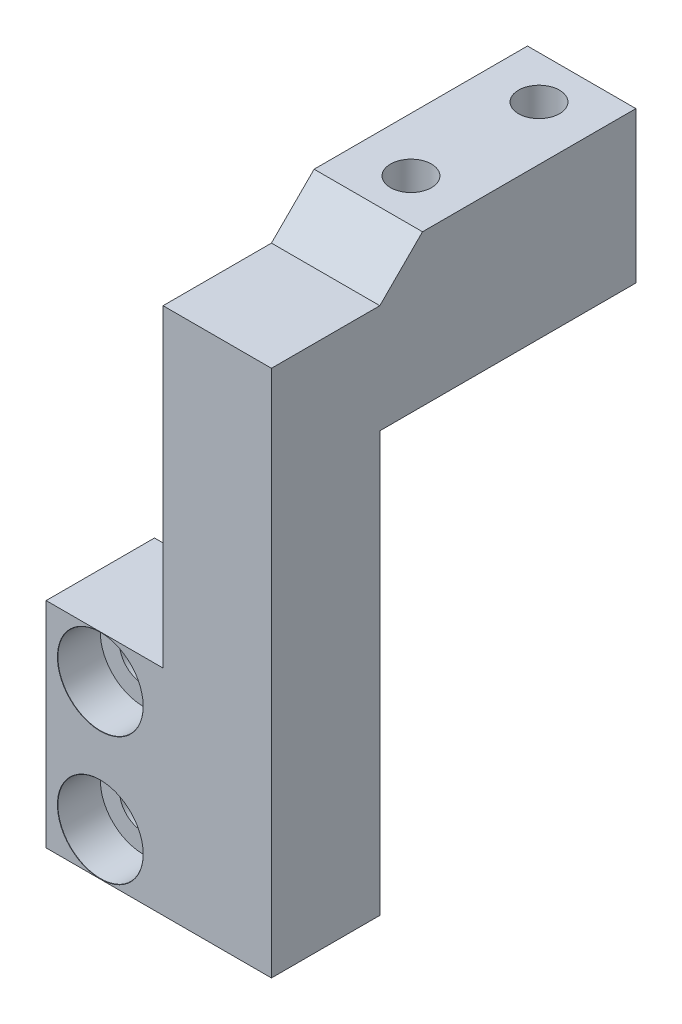
from build123d import *

# Parameters (mm, degrees)
SKETCH2_W                     = 12.7
SKETCH2_H                     = 84
BOSS_EXTRUDE1_DEPTH           = 12.7
SKETCH5_W                     = 12.7
SKETCH5_H                     = 25
BOSS_EXTRUDE2_DEPTH           = 5
CBORE_FOR_M4_SHCS1_AT_2_COUNT = 2
CBORE_FOR_M4_SHCS1_AT_2_PITCH = 15
CHAMFER1_SIZE                 = 5
SKETCH6_W                     = 41.3
SKETCH6_H                     = 12.7
CUT_EXTRUDE1_DEPTH            = 48.313634399
SKETCH7_W                     = 12.7
SKETCH7_H                     = 12.7
BOSS_EXTRUDE3_DEPTH           = 49.17
SKETCH9_W                     = 12.7
SKETCH9_H                     = 25.1
BOSS_EXTRUDE4_DEPTH           = 13.7
CBORE_FOR_M5_SHCS2_AT_2_COUNT = 2
CBORE_FOR_M5_SHCS2_AT_2_PITCH = 15


with BuildPart() as part:
    # Sketch2 → Boss-Extrude1 (new body)
    with BuildSketch(Plane(origin=(0, 0, 0), x_dir=(1, 0, 0), z_dir=(0, 1, 0))):
        Rectangle(SKETCH2_W, SKETCH2_H)
    extrude(amount=BOSS_EXTRUDE1_DEPTH)

    # Sketch5 → Boss-Extrude2 (add)
    with BuildSketch(Plane(origin=(0, 12.7, 0), x_dir=(1, 0, 0), z_dir=(0, 1, 0))):
        with Locations((0, 29.5)):
            Rectangle(SKETCH5_W, SKETCH5_H)
    extrude(amount=BOSS_EXTRUDE2_DEPTH)

    # Sketch4 → CBORE for M4 SHCS1 (revolve, cut)
    with BuildSketch(Plane(origin=(0, 0, -37), x_dir=(0, 0, -1), z_dir=(1, 0, 0))):
        Polygon((0, 0), (0, 17.7), (2.4, 17.7), (2.4, 4), (4, 4), (4, 0.020977491), (4.025, 0), align=None)
    cbore_for_m4_shcs1 = revolve(axis=Axis((0, -6.35, -37), (0, 1, 0)), mode=Mode.SUBTRACT)

    # CBORE for M4 SHCS1 at 2: CBORE for M4 SHCS1 ×2
    with Locations(*[(0, 0, i * CBORE_FOR_M4_SHCS1_AT_2_PITCH) for i in range(1, CBORE_FOR_M4_SHCS1_AT_2_COUNT)]):
        add(cbore_for_m4_shcs1, mode=Mode.SUBTRACT)

    # Chamfer1
    chamfer1_edges = [part.edges().sort_by_distance(p)[0] for p in [
        (0, 12.7, -17),
    ]]
    chamfer(chamfer1_edges, length=CHAMFER1_SIZE - 0.0001)  # a hair under: the kernel refuses the full size

    # Sketch6 → Cut-Extrude1 (cut, through all)
    with BuildSketch(Plane(origin=(6.35, 0, 0), x_dir=(0, 0, -1), z_dir=(1, 0, 0))):
        with Locations((-21.35, 6.35)):
            Rectangle(SKETCH6_W, SKETCH6_H)
    extrude(amount=-CUT_EXTRUDE1_DEPTH, mode=Mode.SUBTRACT)

    # Sketch7 → Boss-Extrude3 (add)
    with BuildSketch(Plane(origin=(0, 0, 0), x_dir=(-1, 0, 0), z_dir=(0, -1, 0))):
        with Locations((0, 5.65)):
            Rectangle(SKETCH7_W, SKETCH7_H)
    extrude(amount=BOSS_EXTRUDE3_DEPTH)

    # Sketch9 → Boss-Extrude4 (add)
    with BuildSketch(Plane(origin=(-6.35, 0, 0), x_dir=(0, 0, -1), z_dir=(1, 0, 0))):
        with Locations((5.65, -36.62)):
            Rectangle(SKETCH9_W, SKETCH9_H)
    extrude(amount=-BOSS_EXTRUDE4_DEPTH)

    # Sketch14 → CBORE for M5 SHCS2 (revolve, cut)
    with BuildSketch(Plane(origin=(-13.7, -29.12, 0.7), x_dir=(0, -1, 0), z_dir=(1, 0, 0))):
        Polygon((0, 0), (0, 42.7), (2.75, 42.7), (2.75, 5), (5, 5), (5, 0.025), (5.025, 0), align=None)
    cbore_for_m5_shcs2 = revolve(axis=Axis((-13.7, -29.12, 7.05), (0, 0, -1)), mode=Mode.SUBTRACT)

    # CBORE for M5 SHCS2 at 2: CBORE for M5 SHCS2 ×2
    with Locations(*[(0, -i * CBORE_FOR_M5_SHCS2_AT_2_PITCH, 0) for i in range(1, CBORE_FOR_M5_SHCS2_AT_2_COUNT)]):
        add(cbore_for_m5_shcs2, mode=Mode.SUBTRACT)


solid = part.part
